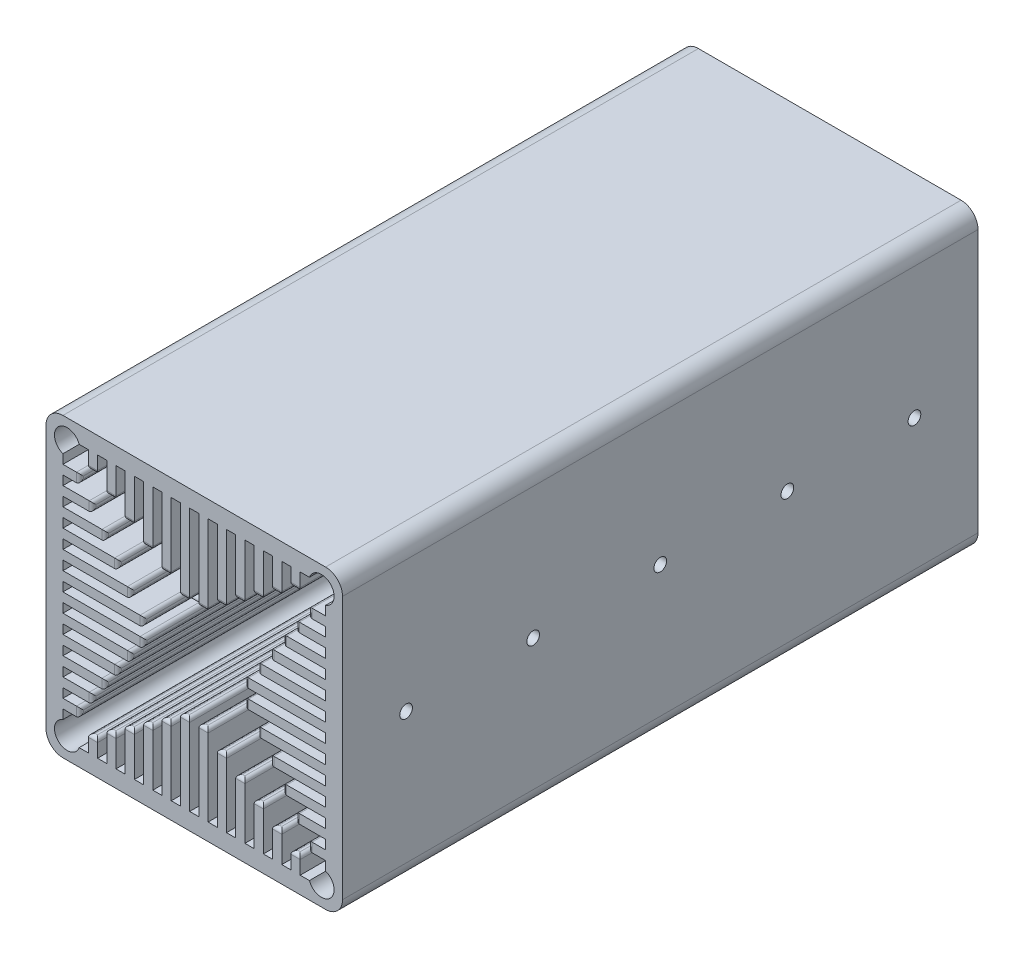
from build123d import *

# Parameters (mm, degrees)
SKETCH1_W           = 70
SKETCH1_H           = 70
BOSS_EXTRUDE1_DEPTH = 150
FILLET1_R           = 4
CUT_EXTRUDE1_DEPTH  = 150
FILLET2_R           = 0.8
CUT_EXTRUDE2_REACH  = 181.722
SKETCH3_R           = 1.5


with BuildPart() as part:
    # Sketch1 → Boss-Extrude1 (new body)
    with BuildSketch(Plane.XY):
        with Locations((35, -35)):
            Rectangle(SKETCH1_W, SKETCH1_H)
    extrude(amount=BOSS_EXTRUDE1_DEPTH)

    # Fillet1
    fillet1_edges = [part.edges().sort_by_distance(p)[0] for p in [
        (0, 0, 75),
        (70, 0, 75),
        (70, -70, 75),
        (0, -70, 75),
    ]]
    fillet(fillet1_edges, radius=FILLET1_R)

    # Sketch2 → Cut-Extrude1 (cut)
    with BuildSketch(Plane.XY.offset(150)):
        with BuildLine():
            Line((7.826086957, -66), (10, -66))
            Line((10, -66), (10, -62))
            Line((10, -62), (12.173913043, -62))
            Line((12.173913043, -62), (12.173913043, -66))
            Line((12.173913043, -66), (14.347826087, -66))
            Line((14.347826087, -66), (14.347826087, -59))
            Line((14.347826087, -59), (16.52173913, -59))
            Line((16.52173913, -59), (16.52173913, -66))
            Line((16.52173913, -66), (18.695652174, -66))
            Line((18.695652174, -66), (18.695652174, -56))
            Line((18.695652174, -56), (20.869565217, -56))
            Line((20.869565217, -56), (20.869565217, -66))
            Line((20.869565217, -66), (23.043478261, -66))
            Line((23.043478261, -66), (23.043478261, -53))
            Line((23.043478261, -53), (25.217391304, -53))
            Line((25.217391304, -53), (25.217391304, -66))
            Line((25.217391304, -66), (27.391304348, -66))
            Line((27.391304348, -66), (27.391304348, -50))
            Line((27.391304348, -50), (29.565217391, -50))
            Line((29.565217391, -50), (29.565217391, -66))
            Line((29.565217391, -66), (31.739130435, -66))
            Line((31.739130435, -66), (31.739130435, -47))
            Line((31.739130435, -47), (33.913043478, -47))
            Line((33.913043478, -47), (33.913043478, -66))
            Line((33.913043478, -66), (36.086956522, -66))
            Line((36.086956522, -66), (36.086956522, -47))
            Line((36.086956522, -47), (38.260869565, -47))
            Line((38.260869565, -47), (38.260869565, -66))
            Line((38.260869565, -66), (40.434782609, -66))
            Line((40.434782609, -66), (40.434782609, -50))
            Line((40.434782609, -50), (42.608695652, -50))
            Line((42.608695652, -50), (42.608695652, -66))
            Line((42.608695652, -66), (44.782608696, -66))
            Line((44.782608696, -66), (44.782608696, -53))
            Line((44.782608696, -53), (46.956521739, -53))
            Line((46.956521739, -53), (46.956521739, -66))
            Line((46.956521739, -66), (49.130434783, -66))
            Line((49.130434783, -66), (49.130434783, -56))
            Line((49.130434783, -56), (51.304347826, -56))
            Line((51.304347826, -56), (51.304347826, -66))
            Line((51.304347826, -66), (53.47826087, -66))
            Line((53.47826087, -66), (53.47826087, -59))
            Line((53.47826087, -59), (55.652173913, -59))
            Line((55.652173913, -59), (55.652173913, -66))
            Line((55.652173913, -66), (57.826086957, -66))
            Line((57.826086957, -66), (57.826086957, -62))
            Line((57.826086957, -62), (60, -62))
            Line((60, -62), (60, -66))
            Line((60, -66), (62.173913043, -66))
            ThreePointArc((62.173913043, -66), (67.124936371, -67.124936371), (66, -62.173913043))
            Line((66, -62.173913043), (66, -60))
            Line((66, -60), (62, -60))
            Line((62, -60), (62, -57.826086957))
            Line((62, -57.826086957), (66, -57.826086957))
            Line((66, -57.826086957), (66, -55.652173913))
            Line((66, -55.652173913), (59, -55.652173913))
            Line((59, -55.652173913), (59, -53.47826087))
            Line((59, -53.47826087), (66, -53.47826087))
            Line((66, -53.47826087), (66, -51.304347826))
            Line((66, -51.304347826), (56, -51.304347826))
            Line((56, -51.304347826), (56, -49.130434783))
            Line((56, -49.130434783), (66, -49.130434783))
            Line((66, -49.130434783), (66, -46.956521739))
            Line((66, -46.956521739), (53, -46.956521739))
            Line((53, -46.956521739), (53, -44.782608696))
            Line((53, -44.782608696), (66, -44.782608696))
            Line((66, -44.782608696), (66, -42.608695652))
            Line((66, -42.608695652), (50, -42.608695652))
            Line((50, -42.608695652), (50, -40.434782609))
            Line((50, -40.434782609), (66, -40.434782609))
            Line((66, -40.434782609), (66, -38.260869565))
            Line((66, -38.260869565), (47, -38.260869565))
            Line((47, -38.260869565), (47, -36.086956522))
            Line((47, -36.086956522), (66, -36.086956522))
            Line((66, -36.086956522), (66, -33.913043478))
            Line((66, -33.913043478), (47, -33.913043478))
            Line((47, -33.913043478), (47, -31.739130435))
            Line((47, -31.739130435), (66, -31.739130435))
            Line((66, -31.739130435), (66, -29.565217391))
            Line((66, -29.565217391), (50, -29.565217391))
            Line((50, -29.565217391), (50, -27.391304348))
            Line((50, -27.391304348), (66, -27.391304348))
            Line((66, -27.391304348), (66, -25.217391304))
            Line((66, -25.217391304), (53, -25.217391304))
            Line((53, -25.217391304), (53, -23.043478261))
            Line((53, -23.043478261), (66, -23.043478261))
            Line((66, -23.043478261), (66, -20.869565217))
            Line((66, -20.869565217), (56, -20.869565217))
            Line((56, -20.869565217), (56, -18.695652174))
            Line((56, -18.695652174), (66, -18.695652174))
            Line((66, -18.695652174), (66, -16.52173913))
            Line((66, -16.52173913), (59, -16.52173913))
            Line((59, -16.52173913), (59, -14.347826087))
            Line((59, -14.347826087), (66, -14.347826087))
            Line((66, -14.347826087), (66, -12.173913043))
            Line((66, -12.173913043), (62, -12.173913043))
            Line((62, -12.173913043), (62, -10))
            Line((62, -10), (66, -10))
            Line((66, -10), (66, -7.826086957))
            ThreePointArc((66, -7.826086957), (67.124936371, -2.875063629), (62.173913043, -4))
            Line((62.173913043, -4), (60, -4))
            Line((60, -4), (60, -8))
            Line((60, -8), (57.826086957, -8))
            Line((57.826086957, -8), (57.826086957, -4))
            Line((57.826086957, -4), (55.652173913, -4))
            Line((55.652173913, -4), (55.652173913, -11))
            Line((55.652173913, -11), (53.47826087, -11))
            Line((53.47826087, -11), (53.47826087, -4))
            Line((53.47826087, -4), (51.304347826, -4))
            Line((51.304347826, -4), (51.304347826, -14))
            Line((51.304347826, -14), (49.130434783, -14))
            Line((49.130434783, -14), (49.130434783, -4))
            Line((49.130434783, -4), (46.956521739, -4))
            Line((46.956521739, -4), (46.956521739, -17))
            Line((46.956521739, -17), (44.782608696, -17))
            Line((44.782608696, -17), (44.782608696, -4))
            Line((44.782608696, -4), (42.608695652, -4))
            Line((42.608695652, -4), (42.608695652, -20))
            Line((42.608695652, -20), (40.434782609, -20))
            Line((40.434782609, -20), (40.434782609, -4))
            Line((40.434782609, -4), (38.260869565, -4))
            Line((38.260869565, -4), (38.260869565, -23))
            Line((38.260869565, -23), (36.086956522, -23))
            Line((36.086956522, -23), (36.086956522, -4))
            Line((36.086956522, -4), (33.913043478, -4))
            Line((33.913043478, -4), (33.913043478, -23))
            Line((33.913043478, -23), (31.739130435, -23))
            Line((31.739130435, -23), (31.739130435, -4))
            Line((31.739130435, -4), (29.565217391, -4))
            Line((29.565217391, -4), (29.565217391, -20))
            Line((29.565217391, -20), (27.391304348, -20))
            Line((27.391304348, -20), (27.391304348, -4))
            Line((27.391304348, -4), (25.217391304, -4))
            Line((25.217391304, -4), (25.217391304, -17))
            Line((25.217391304, -17), (23.043478261, -17))
            Line((23.043478261, -17), (23.043478261, -4))
            Line((23.043478261, -4), (20.869565217, -4))
            Line((20.869565217, -4), (20.869565217, -14))
            Line((20.869565217, -14), (18.695652174, -14))
            Line((18.695652174, -14), (18.695652174, -4))
            Line((18.695652174, -4), (16.52173913, -4))
            Line((16.52173913, -4), (16.52173913, -11))
            Line((16.52173913, -11), (14.347826087, -11))
            Line((14.347826087, -11), (14.347826087, -4))
            Line((14.347826087, -4), (12.173913043, -4))
            Line((12.173913043, -4), (12.173913043, -8))
            Line((12.173913043, -8), (10, -8))
            Line((10, -8), (10, -4))
            Line((10, -4), (7.826086957, -4))
            ThreePointArc((7.826086957, -4), (2.875063629, -2.875063629), (4, -7.826086957))
            Line((4, -7.826086957), (4, -10))
            Line((4, -10), (8, -10))
            Line((8, -10), (8, -12.173913043))
            Line((8, -12.173913043), (4, -12.173913043))
            Line((4, -12.173913043), (4, -14.347826087))
            Line((4, -14.347826087), (11, -14.347826087))
            Line((11, -14.347826087), (11, -16.52173913))
            Line((11, -16.52173913), (4, -16.52173913))
            Line((4, -16.52173913), (4, -18.695652174))
            Line((4, -18.695652174), (14, -18.695652174))
            Line((14, -18.695652174), (14, -20.869565217))
            Line((14, -20.869565217), (4, -20.869565217))
            Line((4, -20.869565217), (4, -23.043478261))
            Line((4, -23.043478261), (17, -23.043478261))
            Line((17, -23.043478261), (17, -25.217391304))
            Line((17, -25.217391304), (4, -25.217391304))
            Line((4, -25.217391304), (4, -27.391304348))
            Line((4, -27.391304348), (20, -27.391304348))
            Line((20, -27.391304348), (20, -29.565217391))
            Line((20, -29.565217391), (4, -29.565217391))
            Line((4, -29.565217391), (4, -31.739130435))
            Line((4, -31.739130435), (23, -31.739130435))
            Line((23, -31.739130435), (23, -33.913043478))
            Line((23, -33.913043478), (4, -33.913043478))
            Line((4, -33.913043478), (4, -36.086956522))
            Line((4, -36.086956522), (23, -36.086956522))
            Line((23, -36.086956522), (23, -38.260869565))
            Line((23, -38.260869565), (4, -38.260869565))
            Line((4, -38.260869565), (4, -40.434782609))
            Line((4, -40.434782609), (20, -40.434782609))
            Line((20, -40.434782609), (20, -42.608695652))
            Line((20, -42.608695652), (4, -42.608695652))
            Line((4, -42.608695652), (4, -44.782608696))
            Line((4, -44.782608696), (17, -44.782608696))
            Line((17, -44.782608696), (17, -46.956521739))
            Line((17, -46.956521739), (4, -46.956521739))
            Line((4, -46.956521739), (4, -49.130434783))
            Line((4, -49.130434783), (14, -49.130434783))
            Line((14, -49.130434783), (14, -51.304347826))
            Line((14, -51.304347826), (4, -51.304347826))
            Line((4, -51.304347826), (4, -53.47826087))
            Line((4, -53.47826087), (11, -53.47826087))
            Line((11, -53.47826087), (11, -55.652173913))
            Line((11, -55.652173913), (4, -55.652173913))
            Line((4, -55.652173913), (4, -57.826086957))
            Line((4, -57.826086957), (8, -57.826086957))
            Line((8, -57.826086957), (8, -60))
            Line((8, -60), (4, -60))
            Line((4, -60), (4, -62.173913043))
            ThreePointArc((4, -62.173913043), (2.875063629, -67.124936371), (7.826086957, -66))
        make_face()
    extrude(amount=-CUT_EXTRUDE1_DEPTH, mode=Mode.SUBTRACT)

    # Fillet2
    fillet2_edges = [part.edges().sort_by_distance(p)[0] for p in [
        (8, -60, 75),
        (8, -57.826086957, 75),
        (11, -55.652173913, 75),
        (11, -53.47826087, 75),
        (14, -51.304347826, 75),
        (14, -49.130434783, 75),
        (17, -46.956521739, 75),
        (17, -44.782608696, 75),
        (20, -42.608695652, 75),
        (20, -40.434782609, 75),
        (23, -38.260869565, 75),
        (23, -36.086956522, 75),
        (23, -33.913043478, 75),
        (23, -31.739130435, 75),
        (20, -29.565217391, 75),
        (20, -27.391304348, 75),
        (17, -25.217391304, 75),
        (17, -23.043478261, 75),
        (14, -20.869565217, 75),
        (14, -18.695652174, 75),
        (11, -16.52173913, 75),
        (11, -14.347826087, 75),
        (8, -12.173913043, 75),
        (8, -10, 75),
        (10, -8, 75),
        (12.173913043, -8, 75),
        (14.347826087, -11, 75),
        (16.52173913, -11, 75),
        (18.695652174, -14, 75),
        (20.869565217, -14, 75),
        (23.043478261, -17, 75),
        (25.217391304, -17, 75),
        (27.391304348, -20, 75),
        (29.565217391, -20, 75),
        (31.739130435, -23, 75),
        (33.913043478, -23, 75),
        (36.086956522, -23, 75),
        (38.260869565, -23, 75),
        (40.434782609, -20, 75),
        (42.608695652, -20, 75),
        (44.782608696, -17, 75),
        (46.956521739, -17, 75),
        (49.130434783, -14, 75),
        (51.304347826, -14, 75),
        (53.47826087, -11, 75),
        (55.652173913, -11, 75),
        (57.826086957, -8, 75),
        (60, -8, 75),
        (62, -10, 75),
        (62, -12.173913043, 75),
        (59, -14.347826087, 75),
        (59, -16.52173913, 75),
        (56, -18.695652174, 75),
        (56, -20.869565217, 75),
        (53, -23.043478261, 75),
        (53, -25.217391304, 75),
        (50, -27.391304348, 75),
        (50, -29.565217391, 75),
        (47, -31.739130435, 75),
        (47, -33.913043478, 75),
        (47, -36.086956522, 75),
        (47, -38.260869565, 75),
        (50, -40.434782609, 75),
        (50, -42.608695652, 75),
        (53, -44.782608696, 75),
        (53, -46.956521739, 75),
        (56, -49.130434783, 75),
        (56, -51.304347826, 75),
        (59, -53.47826087, 75),
        (59, -55.652173913, 75),
        (62, -57.826086957, 75),
        (62, -60, 75),
        (60, -62, 75),
        (57.826086957, -62, 75),
        (55.652173913, -59, 75),
        (53.47826087, -59, 75),
        (51.304347826, -56, 75),
        (49.130434783, -56, 75),
        (46.956521739, -53, 75),
        (44.782608696, -53, 75),
        (42.608695652, -50, 75),
        (40.434782609, -50, 75),
        (38.260869565, -47, 75),
        (36.086956522, -47, 75),
        (33.913043478, -47, 75),
        (31.739130435, -47, 75),
        (29.565217391, -50, 75),
        (27.391304348, -50, 75),
        (25.217391304, -53, 75),
        (23.043478261, -53, 75),
        (20.869565217, -56, 75),
        (18.695652174, -56, 75),
        (16.52173913, -59, 75),
        (14.347826087, -59, 75),
        (12.173913043, -62, 75),
        (10, -62, 75),
        (11.086956522, -62, 150),
        (15.434782609, -59, 150),
        (19.782608696, -56, 150),
        (24.130434783, -53, 150),
        (28.47826087, -50, 150),
        (32.826086957, -47, 150),
        (37.173913043, -47, 150),
        (41.52173913, -50, 150),
        (45.869565217, -53, 150),
        (50.217391304, -56, 150),
        (54.565217391, -59, 150),
        (58.913043478, -62, 150),
        (62, -58.913043478, 150),
        (59, -54.565217391, 150),
        (56, -50.217391304, 150),
        (53, -45.869565217, 150),
        (50, -41.52173913, 150),
        (47, -37.173913043, 150),
        (47, -32.826086957, 150),
        (50, -28.47826087, 150),
        (53, -24.130434783, 150),
        (56, -19.782608696, 150),
        (59, -15.434782609, 150),
        (62, -11.086956522, 150),
        (58.913043478, -8, 150),
        (54.565217391, -11, 150),
        (50.217391304, -14, 150),
        (45.869565217, -17, 150),
        (41.52173913, -20, 150),
        (37.173913043, -23, 150),
        (32.826086957, -23, 150),
        (28.47826087, -20, 150),
        (24.130434783, -17, 150),
        (19.782608696, -14, 150),
        (15.434782609, -11, 150),
        (11.086956522, -8, 150),
        (8, -11.086956522, 150),
        (11, -15.434782609, 150),
        (14, -19.782608696, 150),
        (17, -24.130434783, 150),
        (20, -28.47826087, 150),
        (23, -32.826086957, 150),
        (23, -37.173913043, 150),
        (20, -41.52173913, 150),
        (17, -45.869565217, 150),
        (14, -50.217391304, 150),
        (11, -54.565217391, 150),
        (8, -58.913043478, 150),
        (8, -58.913043478, 0),
        (11, -54.565217391, 0),
        (14, -50.217391304, 0),
        (17, -45.869565217, 0),
        (20, -41.52173913, 0),
        (23, -37.173913043, 0),
        (23, -32.826086957, 0),
        (20, -28.47826087, 0),
        (17, -24.130434783, 0),
        (14, -19.782608696, 0),
        (11, -15.434782609, 0),
        (8, -11.086956522, 0),
        (11.086956522, -8, 0),
        (15.434782609, -11, 0),
        (19.782608696, -14, 0),
        (24.130434783, -17, 0),
        (28.47826087, -20, 0),
        (32.826086957, -23, 0),
        (37.173913043, -23, 0),
        (41.52173913, -20, 0),
        (45.869565217, -17, 0),
        (50.217391304, -14, 0),
        (54.565217391, -11, 0),
        (58.913043478, -8, 0),
        (62, -11.086956522, 0),
        (59, -15.434782609, 0),
        (56, -19.782608696, 0),
        (53, -24.130434783, 0),
        (50, -28.47826087, 0),
        (47, -32.826086957, 0),
        (47, -37.173913043, 0),
        (50, -41.52173913, 0),
        (53, -45.869565217, 0),
        (56, -50.217391304, 0),
        (59, -54.565217391, 0),
        (62, -58.913043478, 0),
        (58.913043478, -62, 0),
        (54.565217391, -59, 0),
        (50.217391304, -56, 0),
        (45.869565217, -53, 0),
        (41.52173913, -50, 0),
        (37.173913043, -47, 0),
        (32.826086957, -47, 0),
        (28.47826087, -50, 0),
        (24.130434783, -53, 0),
        (19.782608696, -56, 0),
        (15.434782609, -59, 0),
        (11.086956522, -62, 0),
    ]]
    fillet(fillet2_edges, radius=FILLET2_R)

    # Cut-Extrude2: up to this face of the body (flat: up to its plane)
    cut_extrude2_end = Plane(part.part.faces().sort_by_distance((0, -35, 75))[0])
    # Sketch3 → Cut-Extrude2 (cut, up to the picked face)
    with BuildSketch(Plane(origin=(70, 0, 0), x_dir=(0, 0, -1), z_dir=(1, 0, 0)), mode=Mode.PRIVATE) as cut_extrude2_sk1:
        with Locations(Location((-135, -35, 0), (0, 0, 90))):
            Circle(SKETCH3_R)
    cut_extrude2_tool1 = split(extrude(cut_extrude2_sk1.sketch, amount=-CUT_EXTRUDE2_REACH, mode=Mode.PRIVATE), bisect_by=cut_extrude2_end, keep=Keep.BOTH, mode=Mode.PRIVATE)
    # Sketch3 → Cut-Extrude2 (cut, up to the picked face)
    with BuildSketch(Plane(origin=(70, 0, 0), x_dir=(0, 0, -1), z_dir=(1, 0, 0)), mode=Mode.PRIVATE) as cut_extrude2_sk2:
        with Locations(Location((-105, -35, 0), (0, 0, 90))):
            Circle(SKETCH3_R)
    cut_extrude2_tool2 = split(extrude(cut_extrude2_sk2.sketch, amount=-CUT_EXTRUDE2_REACH, mode=Mode.PRIVATE), bisect_by=cut_extrude2_end, keep=Keep.BOTH, mode=Mode.PRIVATE)
    # Sketch3 → Cut-Extrude2 (cut, up to the picked face)
    with BuildSketch(Plane(origin=(70, 0, 0), x_dir=(0, 0, -1), z_dir=(1, 0, 0)), mode=Mode.PRIVATE) as cut_extrude2_sk3:
        with Locations(Location((-75, -35, 0), (0, 0, 90))):
            Circle(SKETCH3_R)
    cut_extrude2_tool3 = split(extrude(cut_extrude2_sk3.sketch, amount=-CUT_EXTRUDE2_REACH, mode=Mode.PRIVATE), bisect_by=cut_extrude2_end, keep=Keep.BOTH, mode=Mode.PRIVATE)
    # Sketch3 → Cut-Extrude2 (cut, up to the picked face)
    with BuildSketch(Plane(origin=(70, 0, 0), x_dir=(0, 0, -1), z_dir=(1, 0, 0)), mode=Mode.PRIVATE) as cut_extrude2_sk4:
        with Locations(Location((-45, -35, 0), (0, 0, 90))):
            Circle(SKETCH3_R)
    cut_extrude2_tool4 = split(extrude(cut_extrude2_sk4.sketch, amount=-CUT_EXTRUDE2_REACH, mode=Mode.PRIVATE), bisect_by=cut_extrude2_end, keep=Keep.BOTH, mode=Mode.PRIVATE)
    # Sketch3 → Cut-Extrude2 (cut, up to the picked face)
    with BuildSketch(Plane(origin=(70, 0, 0), x_dir=(0, 0, -1), z_dir=(1, 0, 0)), mode=Mode.PRIVATE) as cut_extrude2_sk5:
        with Locations(Location((-15, -35, 0), (0, 0, 90))):
            Circle(SKETCH3_R)
    cut_extrude2_tool5 = split(extrude(cut_extrude2_sk5.sketch, amount=-CUT_EXTRUDE2_REACH, mode=Mode.PRIVATE), bisect_by=cut_extrude2_end, keep=Keep.BOTH, mode=Mode.PRIVATE)
    add(cut_extrude2_tool1.solids().sort_by(Axis((70, -35, 135), (-1, 0, 0)))[0], mode=Mode.SUBTRACT)
    add(cut_extrude2_tool2.solids().sort_by(Axis((70, -35, 105), (-1, 0, 0)))[0], mode=Mode.SUBTRACT)
    add(cut_extrude2_tool3.solids().sort_by(Axis((70, -35, 75), (-1, 0, 0)))[0], mode=Mode.SUBTRACT)
    add(cut_extrude2_tool4.solids().sort_by(Axis((70, -35, 45), (-1, 0, 0)))[0], mode=Mode.SUBTRACT)
    add(cut_extrude2_tool5.solids().sort_by(Axis((70, -35, 15), (-1, 0, 0)))[0], mode=Mode.SUBTRACT)


solid = part.part
